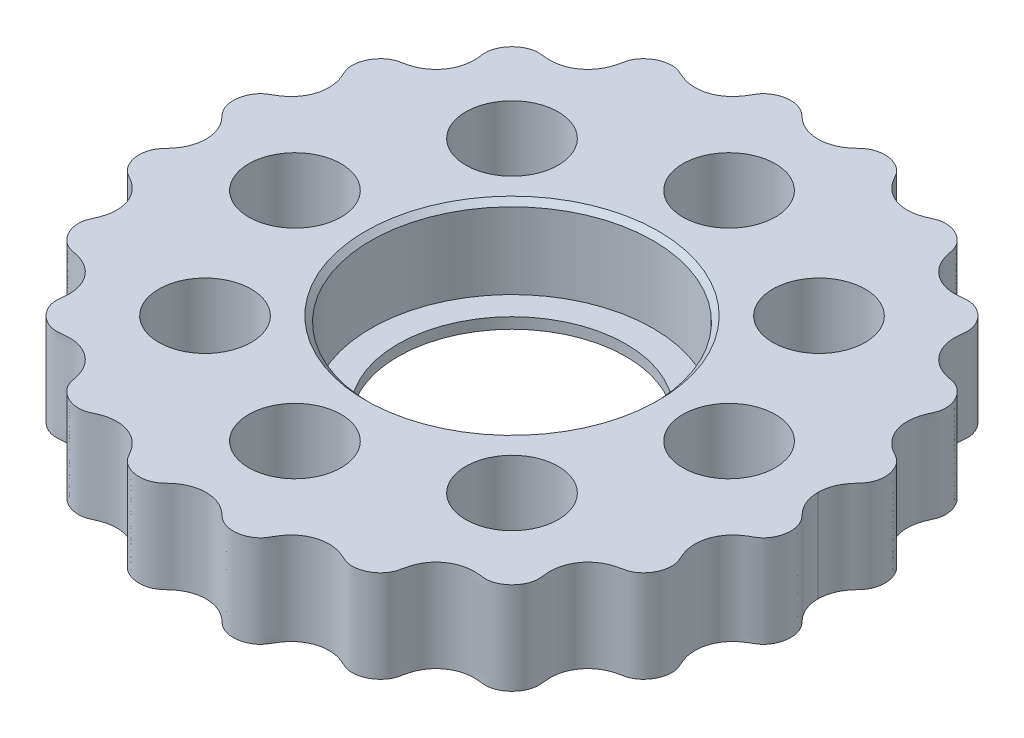
from build123d import *

# Parameters (mm, degrees)
BOSS_EXTRUDE1_OUTLINE_R   = 8.52
BOSS_EXTRUDE1_OUTLINE_R_2 = 26
BOSS_EXTRUDE1_DEPTH       = 17
SKETCH4_R                 = 26
SKETCH4_R_2               = 21
BOSS_EXTRUDE2_DEPTH       = 2
CHAMFER1_SIZE             = 1


# Read off the part's stored shape, not the designer's step: Boss-Extrude1
with BuildPart() as part:
    # Boss-Extrude1 outline → Boss-Extrude1 (new body)
    with BuildSketch(Plane(origin=(0, 0, 0), x_dir=(1, 0, 0), z_dir=(0, 1, 0))):
        with BuildLine():
            add(Edge.make_bspline(
                [(56.38, 0), (56.38, 0.065732344), (56.382107764, 0.190761857), (56.394702859, 0.492100341), (56.438946351, 0.96583163), (56.61446731, 1.931600915), (57.111860783, 3.232890689), (58.038128063, 4.63252989), (59.238374528, 5.775907332), (59.945179899, 7.234056863), (60.113947708, 8.861366074), (59.813983303, 10.462246339), (59.183150688, 11.66663008), (58.457510045, 12.461436908), (57.803304323, 12.925325033), (57.079636906, 13.315541558), (56.141335474, 13.904283252), (55.080248498, 14.810998864), (54.093762189, 16.169255011), (53.459782044, 17.723993937), (53.218782893, 19.385520957), (53.377027505, 21.055630216), (53.910403523, 22.642558498), (54.665990384, 24.101222464), (54.741628263, 25.73433683), (54.31215626, 27.306159339), (53.448978539, 28.689399952), (52.418494691, 29.577760711), (51.446414109, 30.033263394), (50.659021392, 30.212859881), (49.84708775, 30.374855198), (48.782198467, 30.684273939), (47.517831152, 31.277771053), (46.208610287, 32.328627143), (45.188694265, 33.662552063), (44.520071723, 35.202271765), (44.230391372, 36.854323153), (44.306038319, 38.246063571), (44.449443921, 39.327070869), (44.411329178, 40.396255429), (43.964661946, 41.684378368), (42.991021362, 42.991029189), (41.684399971, 43.964648102), (40.396215554, 44.411332545), (39.327114905, 44.449412619), (38.246007606, 44.30600927), (36.854345426, 44.230409537), (35.202262297, 44.520066747), (33.662533514, 45.188704819), (32.328619951, 46.208620165), (31.277784236, 47.517829675), (30.684254836, 48.782262187), (30.374816436, 49.84705871), (30.212898968, 50.65896564), (30.033205378, 51.446438428), (29.577812306, 52.418491786), (28.689378502, 53.448982318), (27.306122559, 54.312203411), (25.734336098, 54.741595088), (24.10103123, 54.666155705), (22.642564491, 53.910326256), (21.055624478, 53.377028886), (19.385503406, 53.218776283), (17.723988853, 53.459792835), (16.169237996, 54.093774436), (14.810994984, 55.080236919), (13.90413273, 56.141332881), (13.315608852, 57.079536922), (12.92566836, 57.803549443), (12.46118621, 58.457554078), (11.666755563, 59.183052034), (10.462233547, 59.814035019), (8.861384582, 60.113950874), (7.234007118, 59.945172514), (5.775955824, 59.238366156), (4.632232562, 58.038167959), (3.234011446, 57.111811352), (1.667170016, 56.515076799), (-4.65e-07, 56.312462631), (-1.667175122, 56.515063643), (-3.234008095, 57.111826223), (-4.632172077, 58.038178816), (-5.775943628, 59.238372311), (-7.234034427, 59.945170509), (-8.861396319, 60.11394841), (-10.462246517, 59.814087422), (-11.666790636, 59.18292097), (-12.461076789, 58.457680296), (-12.926161641, 57.803513238), (-13.314751518, 57.079167762), (-13.904902076, 56.141899614), (-14.810848037, 55.080134228), (-16.169291689, 54.093793737), (-17.72394616, 53.459770068), (-19.385520587, 53.218788041), (-21.055627365, 53.377030777), (-22.642565283, 53.910326889), (-24.101030988, 54.666155487), (-25.734336191, 54.741595153), (-27.306122502, 54.312203368), (-28.689378511, 53.44898233), (-29.577812301, 52.418491788), (-30.033205382, 51.446438431), (-30.212898968, 50.658965641), (-30.374816436, 49.84705871), (-30.684254835, 48.782262187), (-31.277784236, 47.517829675), (-32.328619951, 46.208620165), (-33.662533514, 45.188704819), (-35.202262297, 44.520066747), (-36.854345426, 44.230409537), (-38.246007606, 44.30600927), (-39.327114905, 44.449412619), (-40.396215554, 44.411332545), (-41.684399971, 43.964648102), (-42.991021362, 42.991029189), (-43.964661946, 41.684378368), (-44.411329177, 40.396255429), (-44.449443921, 39.327070869), (-44.306038318, 38.24606357), (-44.230391374, 36.854323154), (-44.520071732, 35.20227176), (-45.188694265, 33.662552061), (-46.208610251, 32.328627164), (-47.517831192, 31.277771031), (-48.782198553, 30.68427389), (-49.847088044, 30.37485504), (-50.659021629, 30.21285956), (-51.446413592, 30.033263648), (-52.418489411, 29.577763516), (-53.448965295, 28.689408788), (-54.31219407, 27.306135562), (-54.741597074, 25.734364558), (-54.666165538, 24.101020025), (-53.910293594, 22.642666717), (-53.377023953, 21.055614465), (-53.218774007, 19.38553506), (-53.459792451, 17.723985449), (-54.093759699, 16.169256727), (-55.080247211, 14.810999682), (-56.141334777, 13.904283712), (-57.079636737, 13.315541669), (-57.803304305, 12.925325042), (-58.457510075, 12.461436875), (-59.183150645, 11.666630117), (-59.813983379, 10.462246449), (-60.11394727, 8.861365888), (-59.945181753, 7.234057331), (-59.238368475, 5.775904167), (-58.038151605, 4.63255308), (-57.111836908, 3.232801745), (-56.614477394, 1.931896124), (-56.438939752, 0.965446856), (-56.394706465, 0.492961863), (-56.382106362, 0.190626228), (-56.38, 0.065740676), (-56.38, 0)],
                knots=[0.061374145, 0.061374145, 0.061374145, 0.061374145, 0.062230836, 0.063087527, 0.06480091, 0.068227674, 0.075081203, 0.081934732, 0.088788261, 0.09564179, 0.102495319, 0.109348848, 0.116202377, 0.119629141, 0.123055906, 0.12648267, 0.129909435, 0.136762964, 0.143616493, 0.150470022, 0.157323551, 0.16417708, 0.171030609, 0.177884138, 0.184737667, 0.191591196, 0.198444725, 0.205298254, 0.208725018, 0.212151783, 0.215578547, 0.219005312, 0.225858841, 0.23271237, 0.239565899, 0.246419428, 0.253272957, 0.260126486, 0.26355325, 0.266980015, 0.273833544, 0.280687073, 0.287540602, 0.294394131, 0.297820895, 0.301247659, 0.308101188, 0.314954717, 0.321808246, 0.328661775, 0.335515304, 0.342368833, 0.345795598, 0.349222362, 0.352649127, 0.356075891, 0.36292942, 0.369782949, 0.376636478, 0.383490007, 0.390343536, 0.397197065, 0.404050594, 0.410904123, 0.417757652, 0.424611181, 0.43146471, 0.434891475, 0.438318239, 0.441745004, 0.445171768, 0.452025297, 0.458878826, 0.465732355, 0.472585884, 0.479439413, 0.486292942, 0.493146471, 0.5, 0.506853529, 0.513707058, 0.520560587, 0.527414116, 0.534267645, 0.541121174, 0.547974703, 0.554828232, 0.558254996, 0.561681761, 0.565108525, 0.56853529, 0.575388819, 0.582242348, 0.589095877, 0.595949406, 0.602802935, 0.609656464, 0.616509993, 0.623363522, 0.630217051, 0.63707058, 0.643924109, 0.647350873, 0.650777638, 0.654204402, 0.657631167, 0.664484696, 0.671338225, 0.678191754, 0.685045283, 0.691898812, 0.698752341, 0.702179105, 0.705605869, 0.712459398, 0.719312927, 0.726166456, 0.733019985, 0.73644675, 0.739873514, 0.746727043, 0.753580572, 0.760434101, 0.76728763, 0.774141159, 0.780994688, 0.784421453, 0.787848217, 0.791274982, 0.794701746, 0.801555275, 0.808408804, 0.815262333, 0.822115862, 0.828969391, 0.83582292, 0.842676449, 0.849529978, 0.856383507, 0.863237036, 0.870090565, 0.87351733, 0.876944094, 0.880370859, 0.883797623, 0.890651152, 0.897504681, 0.90435821, 0.911211739, 0.918065268, 0.924918797, 0.931772326, 0.93519909, 0.936912473, 0.937769164, 0.938625855, 0.938625855, 0.938625855, 0.938625855], degree=3))
            add(Edge.make_bspline(
                [(-56.38, 0), (-56.38, -0.065740676), (-56.382106362, -0.190626228), (-56.394706465, -0.492961862), (-56.438939752, -0.965446856), (-56.614477394, -1.931896124), (-57.111836908, -3.232801744), (-58.038151605, -4.632553079), (-59.238368475, -5.775904167), (-59.945181753, -7.23405733), (-60.11394727, -8.861365888), (-59.813983379, -10.462246449), (-59.183150645, -11.666630117), (-58.457510075, -12.461436875), (-57.803304305, -12.925325042), (-57.079636737, -13.315541668), (-56.141334777, -13.904283712), (-55.080247211, -14.810999682), (-54.093759699, -16.169256727), (-53.459792451, -17.723985449), (-53.218774007, -19.38553506), (-53.377023953, -21.055614465), (-53.910293594, -22.642666717), (-54.666165538, -24.101020025), (-54.741597074, -25.734364558), (-54.31219407, -27.306135562), (-53.448965295, -28.689408788), (-52.418489411, -29.577763516), (-51.446413592, -30.033263648), (-50.659021629, -30.212859559), (-49.847088044, -30.37485504), (-48.782198553, -30.68427389), (-47.517831192, -31.277771031), (-46.208610251, -32.328627164), (-45.188694265, -33.662552061), (-44.520071732, -35.20227176), (-44.230391374, -36.854323154), (-44.306038318, -38.24606357), (-44.449443921, -39.327070869), (-44.411329177, -40.396255429), (-43.964661946, -41.684378368), (-42.991021362, -42.991029189), (-41.684399971, -43.964648102), (-40.396215554, -44.411332545), (-39.327114905, -44.449412619), (-38.246007606, -44.30600927), (-36.854345426, -44.230409537), (-35.202262297, -44.520066747), (-33.662533514, -45.188704819), (-32.328619951, -46.208620165), (-31.277784236, -47.517829675), (-30.684254835, -48.782262187), (-30.374816436, -49.84705871), (-30.212898968, -50.658965641), (-30.033205382, -51.446438431), (-29.577812301, -52.418491788), (-28.689378511, -53.44898233), (-27.306122502, -54.312203368), (-25.734336191, -54.741595152), (-24.101030988, -54.666155487), (-22.642565283, -53.910326889), (-21.055627365, -53.377030777), (-19.385520587, -53.218788041), (-17.72394616, -53.459770068), (-16.169291689, -54.093793737), (-14.810848037, -55.080134227), (-13.904902076, -56.141899614), (-13.314751518, -57.079167762), (-12.926161642, -57.803513238), (-12.461076789, -58.457680296), (-11.666790636, -59.18292097), (-10.462246517, -59.814087422), (-8.861396319, -60.11394841), (-7.234034427, -59.945170509), (-5.775943628, -59.238372311), (-4.632172077, -58.038178816), (-3.234008095, -57.111826223), (-1.667175122, -56.515063643), (-4.65e-07, -56.312462631), (1.667170016, -56.515076799), (3.234011446, -57.111811352), (4.632232562, -58.038167959), (5.775955824, -59.238366156), (7.234007118, -59.945172514), (8.861384582, -60.113950874), (10.462233547, -59.814035019), (11.666755563, -59.183052034), (12.46118621, -58.457554078), (12.92566836, -57.803549443), (13.315608852, -57.079536922), (13.90413273, -56.141332881), (14.810994984, -55.080236919), (16.169237996, -54.093774435), (17.723988853, -53.459792835), (19.385503406, -53.218776283), (21.055624478, -53.377028886), (22.642564491, -53.910326256), (24.10103123, -54.666155705), (25.734336098, -54.741595088), (27.306122559, -54.312203411), (28.689378502, -53.448982317), (29.577812306, -52.418491786), (30.033205378, -51.446438427), (30.212898968, -50.65896564), (30.374816436, -49.84705871), (30.684254836, -48.782262187), (31.277784236, -47.517829675), (32.328619951, -46.208620165), (33.662533514, -45.188704819), (35.202262297, -44.520066747), (36.854345426, -44.230409537), (38.246007606, -44.30600927), (39.327114905, -44.449412619), (40.396215554, -44.411332545), (41.684399971, -43.964648102), (42.991021362, -42.991029189), (43.964661946, -41.684378368), (44.411329178, -40.396255429), (44.449443921, -39.327070869), (44.306038319, -38.246063571), (44.230391372, -36.854323153), (44.520071723, -35.202271765), (45.188694265, -33.662552062), (46.208610287, -32.328627143), (47.517831152, -31.277771053), (48.782198467, -30.684273939), (49.84708775, -30.374855197), (50.659021392, -30.212859881), (51.446414109, -30.033263394), (52.418494691, -29.577760711), (53.448978539, -28.689399952), (54.31215626, -27.306159339), (54.741628263, -25.73433683), (54.665990384, -24.101222464), (53.910403523, -22.642558498), (53.377027504, -21.055630216), (53.218782893, -19.385520957), (53.459782044, -17.723993937), (54.093762189, -16.169255011), (55.080248498, -14.810998864), (56.141335474, -13.904283252), (57.079636906, -13.315541558), (57.803304324, -12.925325032), (58.457510045, -12.461436907), (59.183150688, -11.66663008), (59.813983303, -10.462246339), (60.113947708, -8.861366074), (59.945179899, -7.234056862), (59.238374527, -5.775907332), (58.038128063, -4.63252989), (57.111860783, -3.232890689), (56.61446731, -1.931600915), (56.438946351, -0.96583163), (56.394702859, -0.492100341), (56.382107764, -0.190761856), (56.38, -0.065732344), (56.38, 0)],
                knots=[0.061374145, 0.061374145, 0.061374145, 0.061374145, 0.062230836, 0.063087527, 0.06480091, 0.068227674, 0.075081203, 0.081934732, 0.088788261, 0.09564179, 0.102495319, 0.109348848, 0.116202377, 0.119629141, 0.123055906, 0.12648267, 0.129909435, 0.136762964, 0.143616493, 0.150470022, 0.157323551, 0.16417708, 0.171030609, 0.177884138, 0.184737667, 0.191591196, 0.198444725, 0.205298254, 0.208725018, 0.212151783, 0.215578547, 0.219005312, 0.225858841, 0.23271237, 0.239565899, 0.246419428, 0.253272957, 0.260126486, 0.26355325, 0.266980015, 0.273833544, 0.280687073, 0.287540602, 0.294394131, 0.297820895, 0.301247659, 0.308101188, 0.314954717, 0.321808246, 0.328661775, 0.335515304, 0.342368833, 0.345795598, 0.349222362, 0.352649127, 0.356075891, 0.36292942, 0.369782949, 0.376636478, 0.383490007, 0.390343536, 0.397197065, 0.404050594, 0.410904123, 0.417757652, 0.424611181, 0.43146471, 0.434891475, 0.438318239, 0.441745004, 0.445171768, 0.452025297, 0.458878826, 0.465732355, 0.472585884, 0.479439413, 0.486292942, 0.493146471, 0.5, 0.506853529, 0.513707058, 0.520560587, 0.527414116, 0.534267645, 0.541121174, 0.547974703, 0.554828232, 0.558254996, 0.561681761, 0.565108525, 0.56853529, 0.575388819, 0.582242348, 0.589095877, 0.595949406, 0.602802935, 0.609656464, 0.616509993, 0.623363522, 0.630217051, 0.63707058, 0.643924109, 0.647350873, 0.650777638, 0.654204402, 0.657631167, 0.664484696, 0.671338225, 0.678191754, 0.685045283, 0.691898812, 0.698752341, 0.702179105, 0.705605869, 0.712459398, 0.719312927, 0.726166456, 0.733019985, 0.73644675, 0.739873514, 0.746727043, 0.753580572, 0.760434101, 0.76728763, 0.774141159, 0.780994688, 0.784421453, 0.787848217, 0.791274982, 0.794701746, 0.801555275, 0.808408804, 0.815262333, 0.822115862, 0.828969391, 0.83582292, 0.842676449, 0.849529978, 0.856383507, 0.863237036, 0.870090565, 0.87351733, 0.876944094, 0.880370859, 0.883797623, 0.890651152, 0.897504681, 0.90435821, 0.911211739, 0.918065268, 0.924918797, 0.931772326, 0.93519909, 0.936912473, 0.937769164, 0.938625855, 0.938625855, 0.938625855, 0.938625855], degree=3))
        make_face()
        with Locations((0, -40)):
            Circle(BOSS_EXTRUDE1_OUTLINE_R, mode=Mode.SUBTRACT)
        with Locations((-40, 0)):
            Circle(BOSS_EXTRUDE1_OUTLINE_R, mode=Mode.SUBTRACT)
        with Locations((-28.284271247, -28.284271247)):
            Circle(BOSS_EXTRUDE1_OUTLINE_R, mode=Mode.SUBTRACT)
        Circle(BOSS_EXTRUDE1_OUTLINE_R_2, mode=Mode.SUBTRACT)
        with Locations((28.284271247, -28.284271247)):
            Circle(BOSS_EXTRUDE1_OUTLINE_R, mode=Mode.SUBTRACT)
        with Locations((40, 0)):
            Circle(BOSS_EXTRUDE1_OUTLINE_R, mode=Mode.SUBTRACT)
        with Locations((-28.284271247, 28.284271247)):
            Circle(BOSS_EXTRUDE1_OUTLINE_R, mode=Mode.SUBTRACT)
        with Locations((0, 40)):
            Circle(BOSS_EXTRUDE1_OUTLINE_R, mode=Mode.SUBTRACT)
        with Locations((28.284271247, 28.284271247)):
            Circle(BOSS_EXTRUDE1_OUTLINE_R, mode=Mode.SUBTRACT)
    extrude(amount=BOSS_EXTRUDE1_DEPTH)

    # Sketch4 → Boss-Extrude2 (add)
    with BuildSketch(Plane(origin=(0, 0, 0), x_dir=(-1, 0, 0), z_dir=(0, -1, 0))):
        with Locations(Location((0, 0, 0), (0, 0, 90))):
            Circle(SKETCH4_R)
        with Locations(Location((0, 0, 0), (0, 0, 90))):
            Circle(SKETCH4_R_2, mode=Mode.SUBTRACT)
    extrude(amount=-BOSS_EXTRUDE2_DEPTH)

    # Chamfer1
    chamfer1_edges = [part.edges().sort_by_distance(p)[0] for p in [
        (-26, 17, 0),
    ]]
    chamfer(chamfer1_edges, length=CHAMFER1_SIZE)


solid = part.part
